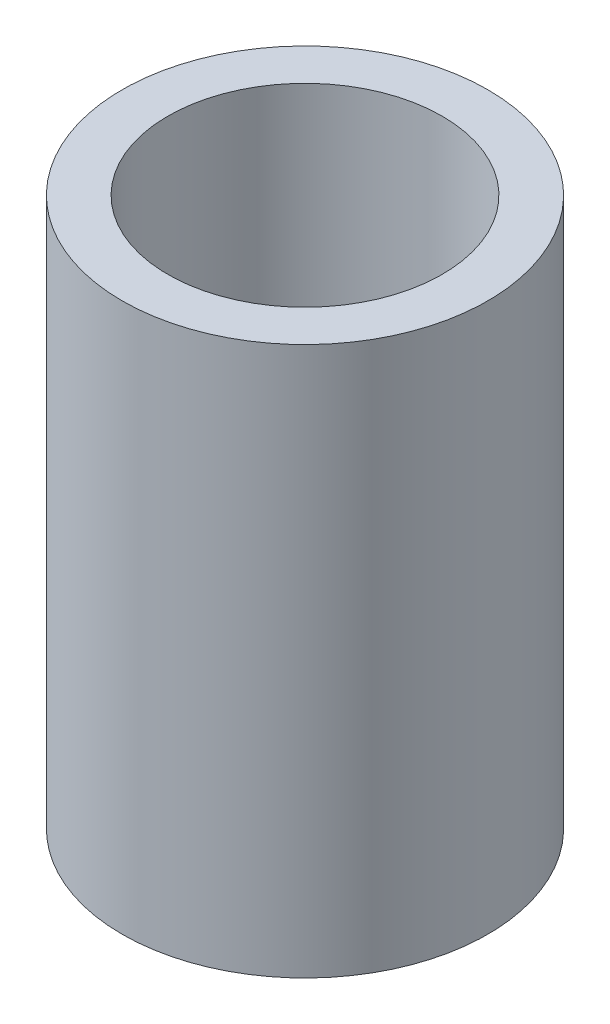
from build123d import *

# Parameters (mm, degrees)
SKETCH1_R           = 12.7
SKETCH1_R_2         = 9.525
BOSS_EXTRUDE2_DEPTH = 38.1


with BuildPart() as part:
    # Sketch1 → Boss-Extrude2 (new body)
    with BuildSketch(Plane(origin=(0, 0, 0), x_dir=(1, 0, 0), z_dir=(0, 1, 0))):
        Circle(SKETCH1_R)
        Circle(SKETCH1_R_2, mode=Mode.SUBTRACT)
    extrude(amount=BOSS_EXTRUDE2_DEPTH)


solid = part.part
